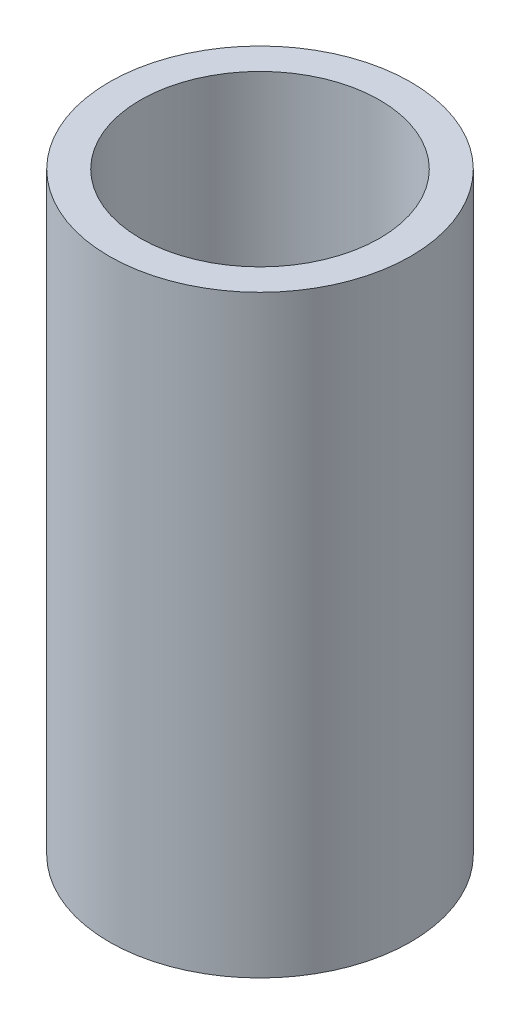
from build123d import *

# Parameters (mm, degrees)
SKETCH1_R           = 4
SKETCH1_R_2         = 3.175
BOSS_EXTRUDE1_DEPTH = 15.748


with BuildPart() as part:
    # Sketch1 → Boss-Extrude1 (new body)
    with BuildSketch(Plane(origin=(0, 0, 0), x_dir=(1, 0, 0), z_dir=(0, 1, 0))):
        Circle(SKETCH1_R)
        Circle(SKETCH1_R_2, mode=Mode.SUBTRACT)
    extrude(amount=BOSS_EXTRUDE1_DEPTH)


solid = part.part
